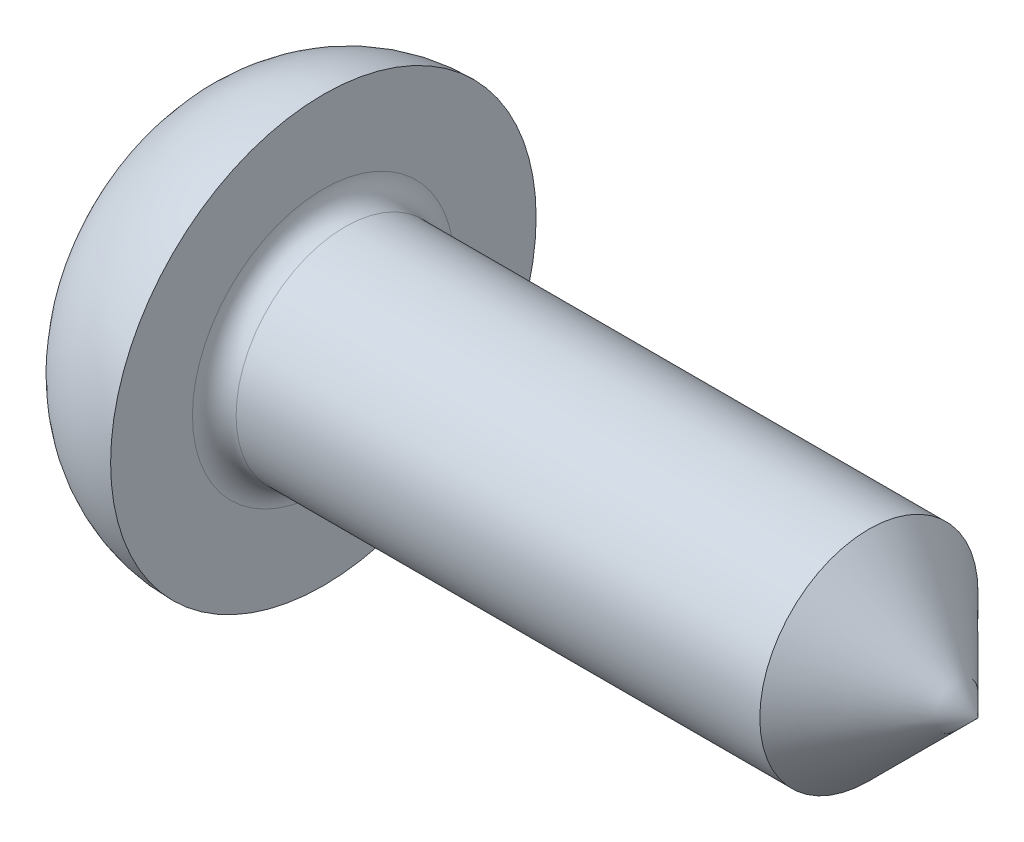
from build123d import *

# Parameters (mm, degrees)
FILLET2_R = 0.2


with BuildPart() as part:
    # Sketch1 → Revolve1 (revolve)
    with BuildSketch(Plane(origin=(0, 0, 0), x_dir=(1, 0, 0), z_dir=(0, 1, 0))):
        with BuildLine():
            Line((1.6, 1), (7.6, 1))
            Line((7.6, 1), (7.6, 0))
            Line((7.6, 0), (0, 0))
            ThreePointArc((0, 0), (0.12318754, 0.742622052), (0.479554358, 1.405694727))
            ThreePointArc((0.479554358, 1.405694727), (0.97590539, 1.809326647), (1.6, 1.95))
            Line((1.6, 1.95), (1.6, 1))
        make_face()
    revolve(axis=Axis((-13.629268293, 0, 0), (1, 0, 0)))

    # Fillet2
    fillet2_edges = [part.edges().sort_by_distance(p)[0] for p in [
        (1.6, 0, 1),
    ]]
    fillet(fillet2_edges, radius=FILLET2_R)

    # Sketch4 → Cut-Revolve1 (revolve, cut)
    with BuildSketch(Plane(origin=(0, 0, 0), x_dir=(1, 0, 0), z_dir=(0, 1, 0))):
        Polygon((8.333454633, 0), (8.333454633, 21), (-13.4, 21), (7.6, 0), align=None)
    revolve(axis=Axis((4.782773752, 0, 0), (1, 0, 0)), mode=Mode.SUBTRACT)

    # Sketch2 → Cut-Loft1 section 0
    with BuildSketch(Plane(origin=(0, 0, 0), x_dir=(0, 0, -1), z_dir=(1, 0, 0)), mode=Mode.PRIVATE) as cut_loft1_s0:
        with BuildLine():
            Line((-0.3125, 0.3125), (-1.25, 0.3125))
            Line((-1.25, 0.3125), (-1.25, -0.3125))
            Line((-1.25, -0.3125), (-0.3125, -0.3125))
            Line((-0.3125, -0.3125), (-0.3125, -1.25))
            Line((-0.3125, -1.25), (0.3125, -1.25))
            Line((0.3125, -1.25), (0.3125, -0.3125))
            Line((0.3125, -0.3125), (1.25, -0.3125))
            Line((1.25, -0.3125), (1.25, 0.3125))
            Line((1.25, 0.3125), (0.3125, 0.3125))
            Line((0.3125, 0.3125), (0.3125, 1.25))
            Line((0.3125, 1.25), (-0.3125, 1.25))
            Line((-0.3125, 1.25), (-0.3125, 0.3125))
        make_face()
    loft([Vertex(1.85, 0, 0), cut_loft1_s0.sketch], mode=Mode.SUBTRACT)


solid = part.part
